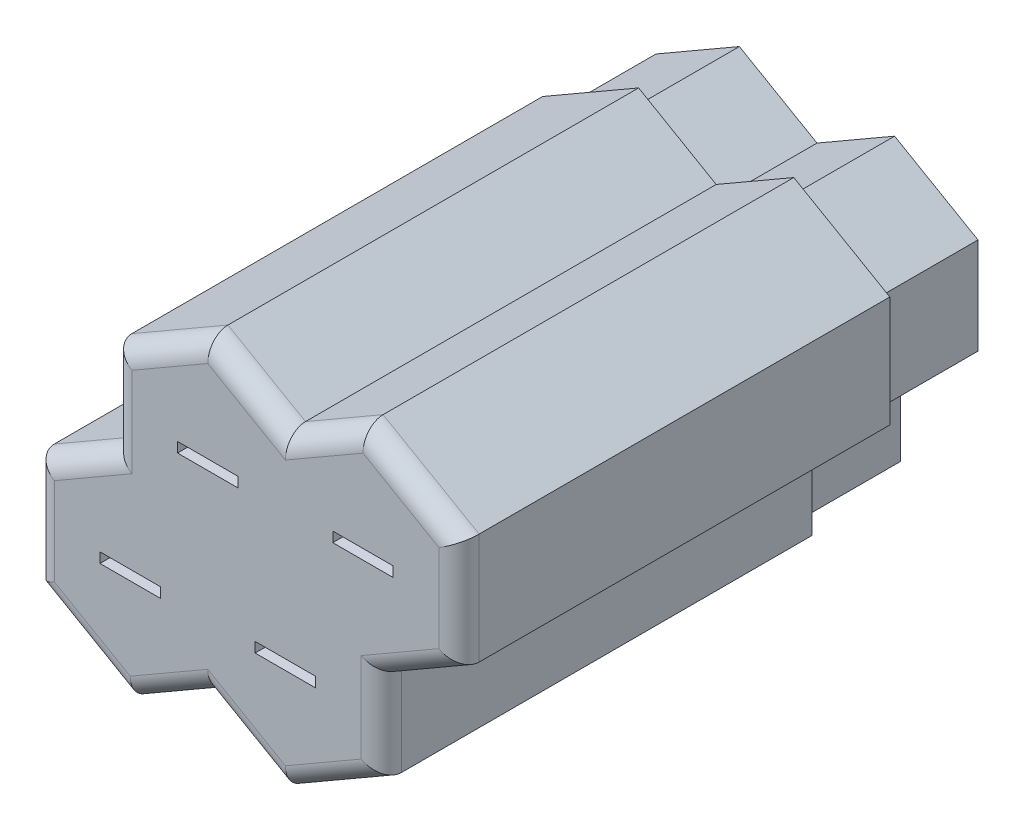
from build123d import *

# Parameters (mm, degrees)
SKETCH2_W           = 6
SKETCH2_H           = 1
BOSS_EXTRUDE1_DEPTH = 2.25
BOSS_EXTRUDE2_DEPTH = 50.5
SKETCH2_5_R         = 5.656929669
CUT_EXTRUDE1_DEPTH  = 0.25
FILLET1_R           = 2
CUT_EXTRUDE3_DEPTH  = 10


with BuildPart() as part:
    # Sketch2 → Boss-Extrude1 (new body)
    with BuildSketch(Plane.XY):
        Polygon((7.7, 6.554402927), (0, 11), (-9.526279442, 5.5), (-9.526279442, -3.391194146), (-17.226279442, -7.836791218), (-17.226279442, -18.836791218), (-7.7, -24.336791218), (0, -19.891194146), (7.7, -24.336791218), (17.226279442, -18.836791218), (17.226279442, -9.945597073), (24.926279442, -5.5), (24.926279442, 5.5), (15.4, 11), align=None)
        Rectangle(SKETCH2_W, SKETCH2_H, mode=Mode.SUBTRACT)
        with Locations((15.401984556, 0.000248069)):
            Rectangle(SKETCH2_W, SKETCH2_H, mode=Mode.SUBTRACT)
        with Locations((-7.698015444, -13.337039288)):
            Rectangle(SKETCH2_W, SKETCH2_H, mode=Mode.SUBTRACT)
        with Locations((7.7, -13.336791218)):
            Rectangle(SKETCH2_W, SKETCH2_H, mode=Mode.SUBTRACT)
    extrude(amount=BOSS_EXTRUDE1_DEPTH)

    # Sketch2<4> → Boss-Extrude2 (add)
    # profile 1 of 3: a face of its own
    with BuildSketch(Plane.XY):
        Polygon((7.7, 6.554402927), (0, 11), (-9.526279442, 5.5), (-9.526279442, -3.391194146), (-17.226279442, -7.836791218), (-17.226279442, -18.836791218), (-7.7, -24.336791218), (0, -19.891194146), (7.7, -24.336791218), (17.226279442, -18.836791218), (17.226279442, -9.945597073), (24.926279442, -5.5), (24.926279442, 5.5), (15.4, 11), align=None)
        with BuildLine():
            Line((7.161688815, 2.828464835), (8.238311185, 2.828464835))
            ThreePointArc((8.238311185, 2.828464835), (22.062914613, 3.859477797), (14.290341933, -7.619623283))
            Line((14.290341933, -7.619623283), (13.743882842, -8.565891912))
            ThreePointArc((13.743882842, -8.565891912), (11.540567196, -20.010623971), (0.538311185, -16.165256053))
            Line((0.538311185, -16.165256053), (-0.538311185, -16.165256053))
            ThreePointArc((-0.538311185, -16.165256053), (-14.438217046, -17.063241411), (-6.288758272, -5.767220769))
            Line((-6.288758272, -5.767220769), (-5.82928192, -5.030852045))
            ThreePointArc((-5.82928192, -5.030852045), (-3.985729856, 6.588167994), (7.161688815, 2.828464835))
        make_face(mode=Mode.SUBTRACT)
    # profile 2 of 3: a face of its own
    with BuildSketch(Plane.XY):
        with BuildLine():
            Line((7.7, -2.336791218), (7.248710822, -2.597343147))
            ThreePointArc((7.248710822, -2.597343147), (6.668395609, -3.85), (5.873720558, -4.978896143))
            Line((5.873720558, -4.978896143), (5.873720558, -5.5))
            Line((5.873720558, -5.5), (6.325009737, -5.760551929))
            ThreePointArc((6.325009737, -5.760551929), (7.7, -5.636791218), (9.074990263, -5.760551929))
            Line((9.074990263, -5.760551929), (9.526279442, -5.5))
            Line((9.526279442, -5.5), (9.526279442, -4.978896143))
            ThreePointArc((9.526279442, -4.978896143), (8.731604391, -3.85), (8.151289178, -2.597343147))
            Line((8.151289178, -2.597343147), (7.7, -2.336791218))
        make_face()
    # profile 3 of 3: a face of its own
    with BuildSketch(Plane.XY):
        with BuildLine():
            ThreePointArc((1.374990263, -7.57623929), (0, -7.7), (-1.374990263, -7.57623929))
            Line((-1.374990263, -7.57623929), (-1.826279442, -7.836791218))
            Line((-1.826279442, -7.836791218), (-1.826279442, -8.357895075))
            ThreePointArc((-1.826279442, -8.357895075), (-1.031604391, -9.486791218), (-0.451289178, -10.739448071))
            Line((-0.451289178, -10.739448071), (0, -11))
            Line((0, -11), (0.451289178, -10.739448071))
            ThreePointArc((0.451289178, -10.739448071), (1.031604391, -9.486791218), (1.826279442, -8.357895075))
            Line((1.826279442, -8.357895075), (1.826279442, -7.836791218))
            Line((1.826279442, -7.836791218), (1.374990263, -7.57623929))
        make_face()
    extrude(amount=-BOSS_EXTRUDE2_DEPTH)

    # Sketch2<5> → Cut-Extrude1 (cut)
    with BuildSketch(Plane.XY):
        with Locations((15.4, 0)):
            Circle(SKETCH2_5_R)
        Circle(SKETCH2_5_R)
        with Locations((7.7, -13.336791218)):
            Circle(SKETCH2_5_R)
        with Locations((-7.7, -13.336791218)):
            Circle(SKETCH2_5_R)
    extrude(amount=CUT_EXTRUDE1_DEPTH, mode=Mode.SUBTRACT)

    # Fillet1
    fillet1_edges = [part.edges().sort_by_distance(p)[0] for p in [
        (3.85, 8.777201464, 2.25),
        (20.163139721, 8.25, 2.25),
        (11.55, 8.777201464, 2.25),
        (24.926279442, 0, 2.25),
        (21.076279442, -7.722798536, 2.25),
        (17.226279442, -14.391194146, 2.25),
        (12.463139721, -21.586791218, 2.25),
        (3.85, -22.113992682, 2.25),
        (-3.85, -22.113992682, 2.25),
        (-12.463139721, -21.586791218, 2.25),
        (-17.226279442, -13.336791218, 2.25),
        (-13.376279442, -5.613992682, 2.25),
        (-9.526279442, 1.054402927, 2.25),
        (-4.763139721, 8.25, 2.25),
    ]]
    fillet(fillet1_edges, radius=FILLET1_R)

    # Sketch7 → Cut-Extrude3 (cut)
    with BuildSketch(Plane(origin=(0, 0, -50.5), x_dir=(-1, 0, 0), z_dir=(0, 0, -1))):
        Polygon((-15.4, 11), (-24.926279442, 5.5), (-24.926279442, -5.5), (-17.226279442, -9.945597073), (-17.226279442, -18.836791218), (-7.7, -24.336791218), (0, -19.891194146), (7.7, -24.336791218), (17.226279442, -18.836791218), (17.226279442, -7.836791218), (9.526279442, -3.391194146), (9.526279442, 5.5), (0, 11), (-7.7, 6.554402927), align=None)
        Polygon((-15.4, 9.556624327), (-7.7, 5.111027254), (0, 9.556624327), (8.276279442, 4.778312164), (8.276279442, -4.112881982), (15.976279442, -8.558479055), (15.976279442, -18.115103382), (7.7, -22.893415545), (0, -18.447818473), (-7.7, -22.893415545), (-15.976279442, -18.115103382), (-15.976279442, -9.223909236), (-23.676279442, -4.778312164), (-23.676279442, 4.778312164), align=None, mode=Mode.SUBTRACT)
    extrude(amount=-CUT_EXTRUDE3_DEPTH, mode=Mode.SUBTRACT)


solid = part.part
